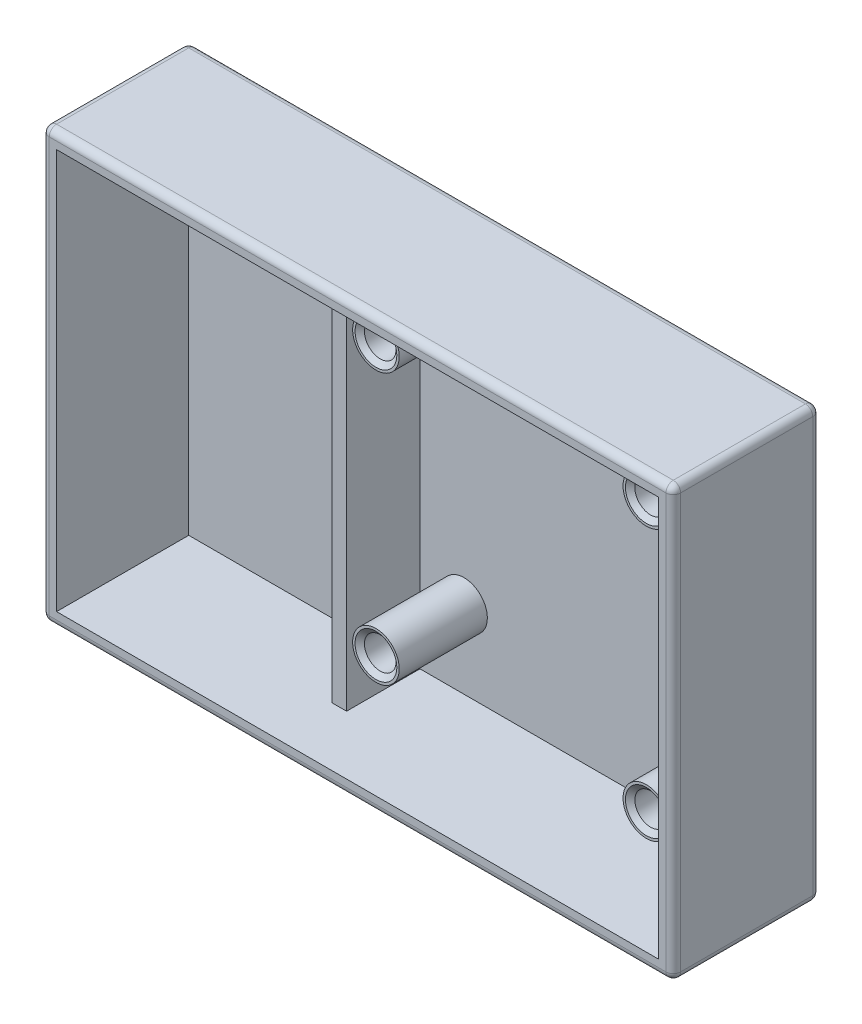
from build123d import *

# Parameters (mm, degrees)
SKETCH1_W                           = 86
SKETCH1_H                           = 58.5
BOSS_EXTRUDE1_DEPTH                 = 20
SHELL1_T                            = -2
SKETCH4_W                           = 2
SKETCH4_H                           = 54.5
BOSS_EXTRUDE2_DEPTH                 = 10
FILLET2_R                           = 1
FILLET3_R                           = 1
SKETCH22_R                          = 3.175
BOSS_EXTRUDE10_DEPTH                = 14
BOSS_EXTRUDE10_2_DEPTH              = 14
BOSS_EXTRUDE10_3_DEPTH              = 14
BOSS_EXTRUDE10_4_DEPTH              = 14
F_4_0_209_DIAMETER_HOLE3_AT_2_COUNT = 2
F_4_0_209_DIAMETER_HOLE3_AT_2_PITCH = 36.83
F_4_0_209_DIAMETER_HOLE3_AT_3_COUNT = 2
F_4_0_209_DIAMETER_HOLE3_AT_3_PITCH = 52.085485502
F_4_0_209_DIAMETER_HOLE3_AT_4_COUNT = 2
F_4_0_209_DIAMETER_HOLE3_AT_4_PITCH = 36.83


with BuildPart() as part:
    # Sketch1 → Boss-Extrude1 (new body)
    with BuildSketch(Plane.XY):
        with Locations((43, 29.25)):
            Rectangle(SKETCH1_W, SKETCH1_H)
    extrude(amount=BOSS_EXTRUDE1_DEPTH)

    # Shell1
    shell1_openings = [part.faces().sort_by_distance(p)[0] for p in [
        (43, 29.25, 20),
    ]]
    offset(amount=SHELL1_T, openings=shell1_openings, kind=Kind.INTERSECTION)

    # Sketch4 → Boss-Extrude2 (add)
    with BuildSketch(Plane.XY.offset(2)):
        with Locations((32.5, 29.25)):
            Rectangle(SKETCH4_W, SKETCH4_H)
    extrude(amount=BOSS_EXTRUDE2_DEPTH)

    # Fillet2
    fillet2_edges = [part.edges().sort_by_distance(p)[0] for p in [
        (86, 29.25, 20),
        (43, 58.5, 20),
        (43, 58.5, 0),
        (86, 29.25, 0),
        (0, 58.5, 10),
        (86, 58.5, 10),
        (86, 0, 10),
    ]]
    fillet(fillet2_edges, radius=FILLET2_R)

    # Fillet3
    # the kernel refuses this fillet: 1 mm, written as the material it takes off along each edge
    with BuildSketch(Plane(origin=(85, 1, 1), x_dir=(0, 0, -1), z_dir=(0, -1, 0))) as fillet3_piece_1_section:
        Polygon((0, 0), (FILLET3_R, 0), (FILLET3_R, FILLET3_R), (0, FILLET3_R), align=None)
    fillet3_piece_1 = extrude(amount=FILLET3_R, mode=Mode.PRIVATE)
    fillet3_piece_1 = fillet3_piece_1 - Plane(origin=(85, 1, 1), x_dir=(-0.7071067811865475, 0, 0.7071067811865475), z_dir=(0, -1, 0)) * Sphere(FILLET3_R, mode=Mode.PRIVATE)
    add(fillet3_piece_1, mode=Mode.SUBTRACT)
    with BuildSketch(Plane(origin=(85, 1, 19), x_dir=(0, 0, 1), z_dir=(0, -1, 0))) as fillet3_piece_2_section:
        Polygon((0, 0), (FILLET3_R, 0), (FILLET3_R, -FILLET3_R), (0, -FILLET3_R), align=None)
    fillet3_piece_2 = extrude(amount=FILLET3_R, mode=Mode.PRIVATE)
    fillet3_piece_2 = fillet3_piece_2 - Plane(origin=(85, 1, 19), x_dir=(-0.7071067811865475, 0, -0.7071067811865475), z_dir=(0, -1, 0)) * Sphere(FILLET3_R, mode=Mode.PRIVATE)
    add(fillet3_piece_2, mode=Mode.SUBTRACT)
    with BuildSketch(Plane(origin=(1, 57.5, 1), x_dir=(-1, 0, 0), z_dir=(0, 0, -1))) as fillet3_piece_3_section:
        Polygon((0, 0), (FILLET3_R, 0), (FILLET3_R, FILLET3_R), (0, FILLET3_R), align=None)
    fillet3_piece_3 = extrude(amount=FILLET3_R, mode=Mode.PRIVATE)
    fillet3_piece_3 = fillet3_piece_3 - Plane(origin=(1, 57.5, 1), x_dir=(0.7071067811865475, -0.7071067811865475, 0), z_dir=(0, 0, -1)) * Sphere(FILLET3_R, mode=Mode.PRIVATE)
    add(fillet3_piece_3, mode=Mode.SUBTRACT)
    with BuildSketch(Plane(origin=(1, 57.5, 19), x_dir=(0, 0, 1), z_dir=(-1, 0, 0))) as fillet3_piece_4_section:
        Polygon((0, 0), (FILLET3_R, 0), (FILLET3_R, FILLET3_R), (0, FILLET3_R), align=None)
    fillet3_piece_4 = extrude(amount=FILLET3_R, mode=Mode.PRIVATE)
    fillet3_piece_4 = fillet3_piece_4 - Plane(origin=(1, 57.5, 19), x_dir=(0, -0.7071067811865475, -0.7071067811865475), z_dir=(-1, 0, 0)) * Sphere(FILLET3_R, mode=Mode.PRIVATE)
    add(fillet3_piece_4, mode=Mode.SUBTRACT)
    with BuildSketch(Plane(origin=(1, 1, 19), x_dir=(-1, 0, 0), z_dir=(0, -1, 0))) as fillet3_piece_5_section:
        Polygon((0, 0), (FILLET3_R, 0), (FILLET3_R, -FILLET3_R), (0, -FILLET3_R), align=None)
    fillet3_piece_5 = extrude(amount=FILLET3_R, mode=Mode.PRIVATE)
    fillet3_piece_5 = fillet3_piece_5 - Plane(origin=(1, 1, 19), x_dir=(0.7071067811865475, 0, -0.7071067811865475), z_dir=(0, -1, 0)) * Sphere(FILLET3_R, mode=Mode.PRIVATE)
    add(fillet3_piece_5, mode=Mode.SUBTRACT)
    with BuildSketch(Plane(origin=(1, 1, 1), x_dir=(0, 0, -1), z_dir=(0, -1, 0))) as fillet3_piece_6_section:
        Polygon((0, 0), (FILLET3_R, 0), (FILLET3_R, -FILLET3_R), (0, -FILLET3_R), align=None)
    fillet3_piece_6 = extrude(amount=FILLET3_R, mode=Mode.PRIVATE)
    fillet3_piece_6 = fillet3_piece_6 - Plane(origin=(1, 1, 1), x_dir=(0.7071067811865475, 0, 0.7071067811865475), z_dir=(0, -1, 0)) * Sphere(FILLET3_R, mode=Mode.PRIVATE)
    add(fillet3_piece_6, mode=Mode.SUBTRACT)
    with BuildSketch(Plane(origin=(0, 57.5, 20), x_dir=(0, 0, -1), z_dir=(0, -1, 0)), Plane(origin=(0, 57.5, 0), x_dir=(1, 0, 0), z_dir=(0, -1, 0))) as fillet3_piece_7:
        with BuildLine():
            CenterArc((FILLET3_R, FILLET3_R), FILLET3_R, 180, 90)
            Line((0, FILLET3_R), (0, 0))
            Line((0, 0), (FILLET3_R, 0))
        make_face()
    extrude(amount=56.5, mode=Mode.SUBTRACT)
    with BuildSketch(Plane(origin=(1, 0, 0), x_dir=(0, 0, 1), z_dir=(1, 0, 0))) as fillet3_piece_8:
        with BuildLine():
            CenterArc((FILLET3_R, -FILLET3_R), FILLET3_R, 90, 90)
            Line((0, -FILLET3_R), (0, 0))
            Line((0, 0), (FILLET3_R, 0))
        make_face()
    extrude(amount=84, mode=Mode.SUBTRACT)
    with BuildSketch(Plane(origin=(1, 0, 20), x_dir=(0, 0, -1), z_dir=(1, 0, 0))) as fillet3_piece_9:
        with BuildLine():
            CenterArc((FILLET3_R, FILLET3_R), FILLET3_R, 180, 90)
            Line((0, FILLET3_R), (0, 0))
            Line((0, 0), (FILLET3_R, 0))
        make_face()
    extrude(amount=84, mode=Mode.SUBTRACT)
    with BuildSketch(Plane(origin=(0, 0, 1), x_dir=(1, 0, 0), z_dir=(0, 0, 1))) as fillet3_piece_10:
        with BuildLine():
            CenterArc((FILLET3_R, FILLET3_R), FILLET3_R, 180, 90)
            Line((0, FILLET3_R), (0, 0))
            Line((0, 0), (FILLET3_R, 0))
        make_face()
    extrude(amount=18, mode=Mode.SUBTRACT)


with BuildPart() as body_2:
    # Sketch22 → Boss-Extrude10 (new body)
    with BuildSketch(Plane.XY):
        with Locations((39.5, 49.415)):
            Circle(SKETCH22_R)
    extrude(amount=BOSS_EXTRUDE10_DEPTH)


with BuildPart() as body_3:
    # Sketch22 → Boss-Extrude10 2 (new body)
    with BuildSketch(Plane.XY):
        with Locations((76.33, 49.415)):
            Circle(SKETCH22_R)
    extrude(amount=BOSS_EXTRUDE10_2_DEPTH)


with BuildPart() as body_4:
    # Sketch22 → Boss-Extrude10 3 (new body)
    with BuildSketch(Plane.XY):
        with Locations((39.5, 12.585)):
            Circle(SKETCH22_R)
    extrude(amount=BOSS_EXTRUDE10_3_DEPTH)


with BuildPart() as body_5:
    # Sketch22 → Boss-Extrude10 4 (new body)
    with BuildSketch(Plane.XY):
        with Locations((76.33, 12.585)):
            Circle(SKETCH22_R)
    extrude(amount=BOSS_EXTRUDE10_4_DEPTH)


with BuildPart() as f_4_0_209_diameter_hole3_tool:
    # Sketch28 → #4 (0.209) Diameter Hole3 (revolve)
    with BuildSketch(Plane(origin=(39.5, 49.415, 14), x_dir=(0, -1, 0), z_dir=(1, 0, 0))):
        Polygon((0, 0), (0, 13.789627147), (2.1463, 12.5), (2.1463, 0.586111092), (2.8448, 0), align=None)
    f_4_0_209_diameter_hole3 = revolve(axis=Axis((39.5, 49.415, 20.35), (0, 0, -1)))


with BuildPart() as part_1:
    add(part.part)

    # #4 (0.209) Diameter Hole3: cut by f_4_0_209_diameter_hole3_tool
    add(f_4_0_209_diameter_hole3_tool.part, mode=Mode.SUBTRACT)


with BuildPart() as body_2_1:
    add(body_2.part)

    # #4 (0.209) Diameter Hole3: cut by f_4_0_209_diameter_hole3_tool
    add(f_4_0_209_diameter_hole3_tool.part, mode=Mode.SUBTRACT)


with BuildPart() as f_4_0_209_diameter_hole3_at_2_tool:
    # #4 (0.209) Diameter Hole3 at 2: #4 (0.209) Diameter Hole3 ×2
    with Locations(*[(0, -i * F_4_0_209_DIAMETER_HOLE3_AT_2_PITCH, 0) for i in range(1, F_4_0_209_DIAMETER_HOLE3_AT_2_COUNT)]):
        add(f_4_0_209_diameter_hole3)


with BuildPart() as part_2:
    add(part_1.part)

    # #4 (0.209) Diameter Hole3 at 2: cut by f_4_0_209_diameter_hole3_at_2_tool
    add(f_4_0_209_diameter_hole3_at_2_tool.part, mode=Mode.SUBTRACT)


with BuildPart() as body_4_1:
    add(body_4.part)

    # #4 (0.209) Diameter Hole3 at 2: cut by f_4_0_209_diameter_hole3_at_2_tool
    add(f_4_0_209_diameter_hole3_at_2_tool.part, mode=Mode.SUBTRACT)


with BuildPart() as f_4_0_209_diameter_hole3_at_3_tool:
    # #4 (0.209) Diameter Hole3 at 3: #4 (0.209) Diameter Hole3 ×2
    with Locations(*[Vector(0.7071067811865478, -0.7071067811865474, 0) * (i * F_4_0_209_DIAMETER_HOLE3_AT_3_PITCH) for i in range(1, F_4_0_209_DIAMETER_HOLE3_AT_3_COUNT)]):
        add(f_4_0_209_diameter_hole3)


with BuildPart() as part_3:
    add(part_2.part)

    # #4 (0.209) Diameter Hole3 at 3: cut by f_4_0_209_diameter_hole3_at_3_tool
    add(f_4_0_209_diameter_hole3_at_3_tool.part, mode=Mode.SUBTRACT)


with BuildPart() as body_5_1:
    add(body_5.part)

    # #4 (0.209) Diameter Hole3 at 3: cut by f_4_0_209_diameter_hole3_at_3_tool
    add(f_4_0_209_diameter_hole3_at_3_tool.part, mode=Mode.SUBTRACT)


with BuildPart() as f_4_0_209_diameter_hole3_at_4_tool:
    # #4 (0.209) Diameter Hole3 at 4: #4 (0.209) Diameter Hole3 ×2
    with Locations(*[(i * F_4_0_209_DIAMETER_HOLE3_AT_4_PITCH, 0, 0) for i in range(1, F_4_0_209_DIAMETER_HOLE3_AT_4_COUNT)]):
        add(f_4_0_209_diameter_hole3)


with BuildPart() as part_4:
    add(part_3.part)

    # #4 (0.209) Diameter Hole3 at 4: cut by f_4_0_209_diameter_hole3_at_4_tool
    add(f_4_0_209_diameter_hole3_at_4_tool.part, mode=Mode.SUBTRACT)


with BuildPart() as body_3_1:
    add(body_3.part)

    # #4 (0.209) Diameter Hole3 at 4: cut by f_4_0_209_diameter_hole3_at_4_tool
    add(f_4_0_209_diameter_hole3_at_4_tool.part, mode=Mode.SUBTRACT)


solid = Compound([body_2_1.part, body_4_1.part, body_5_1.part, part_4.part, body_3_1.part])
